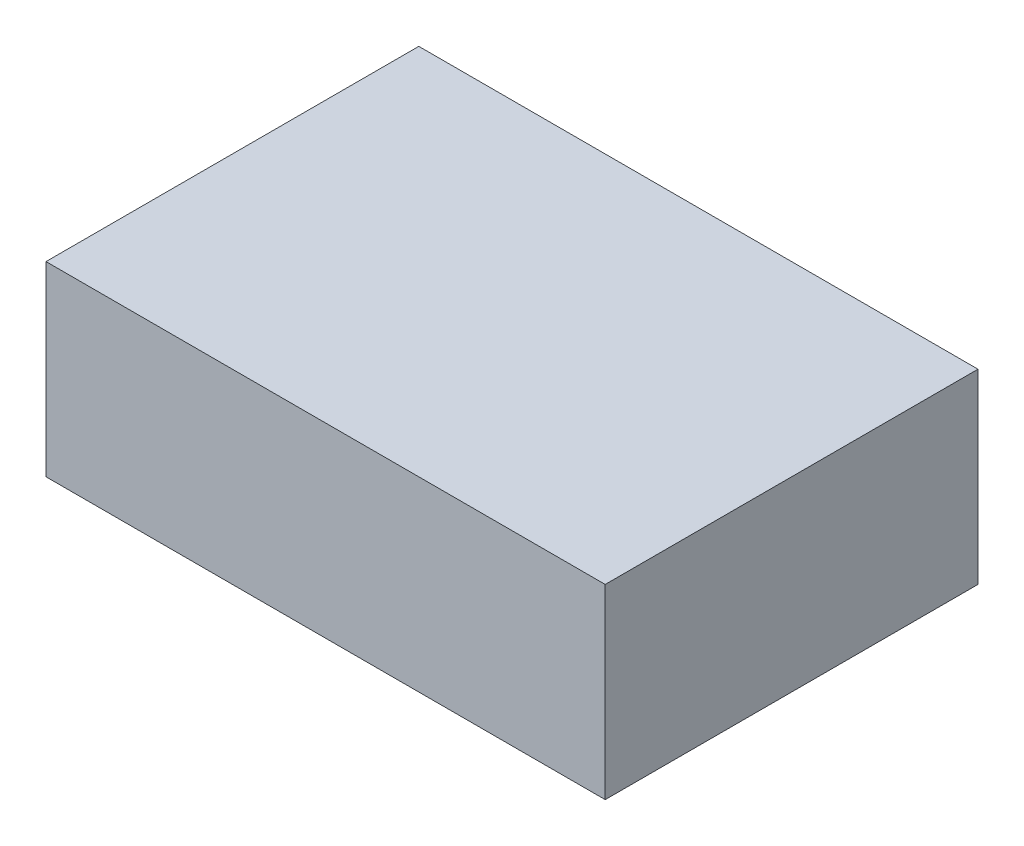
from build123d import *

# Parameters (mm, degrees)
SKETCH1_W           = 76.2
SKETCH1_H           = 50.8
BOSS_EXTRUDE1_DEPTH = 25.4


with BuildPart() as part:
    # Sketch1 → Boss-Extrude1 (new body)
    with BuildSketch(Plane(origin=(0, 0, 0), x_dir=(1, 0, 0), z_dir=(0, 1, 0))):
        Rectangle(SKETCH1_W, SKETCH1_H)
    extrude(amount=BOSS_EXTRUDE1_DEPTH)


solid = part.part
